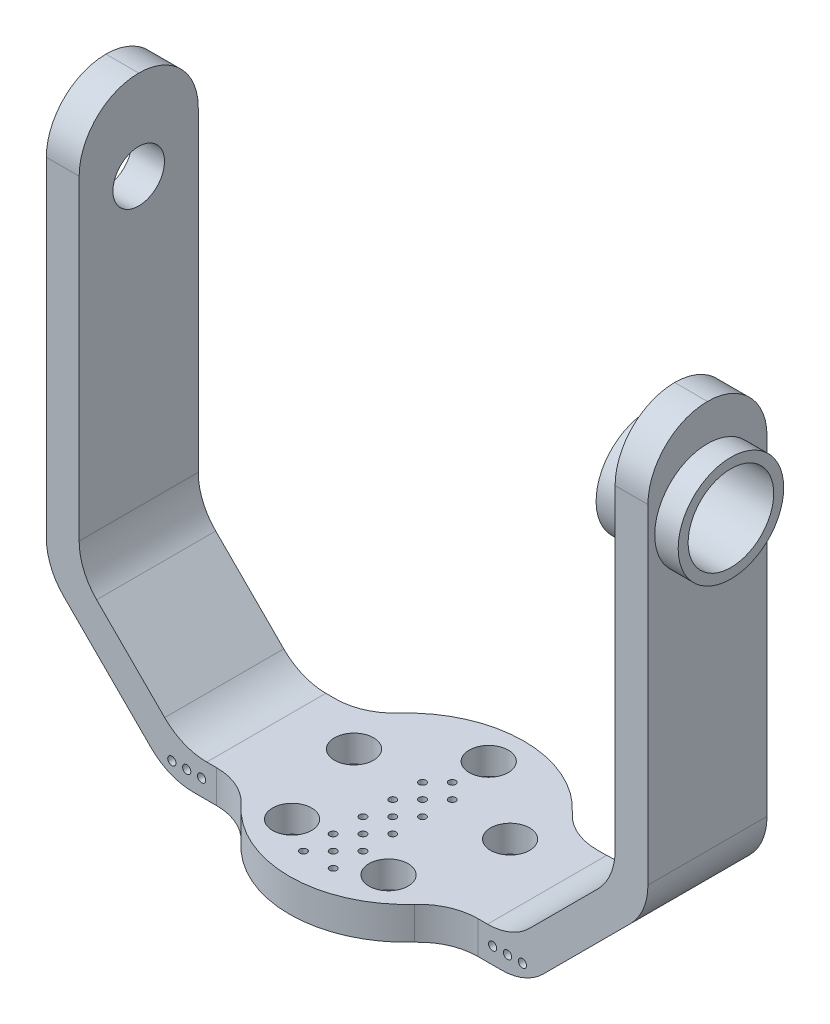
from build123d import *

# Parameters (mm, degrees)
BOSS_EXTRUDE5_DEPTH     = 50.8
SKETCH12_R              = 11
CUT_EXTRUDE2_DEPTH      = 339.34190641
SKETCH11_R              = 50
BOSS_EXTRUDE6_DEPTH     = 14
FILLET3_R               = 25.4
CUT_EXTRUDE3_DEPTH      = 262.148772557
CUT_EXTRUDE3_DEPTH_BACK = 262.148772557
SKETCH13_R              = 3.25
SKETCH14_R              = 8.33
CUT_EXTRUDE4_DEPTH      = 11.43
SKETCH15_R              = 12.5
CUT_EXTRUDE5_DEPTH      = 6.35
CUT_EXTRUDE7_DEPTH      = 262.148772557
CUT_EXTRUDE7_DEPTH_BACK = 262.148772557
SKETCH17_R              = 1.5
CUT_EXTRUDE8_DEPTH      = 262.148772557
CUT_EXTRUDE8_DEPTH_BACK = 262.148772557
SKETCH18_R              = 1.75
SKETCH20_R              = 18.25
CUT_EXTRUDE9_DEPTH      = 13.99794
SKETCH22_R              = 22.5
SKETCH22_R_2            = 18.25
BOSS_EXTRUDE8_DEPTH     = 6.00206
SKETCH23_R              = 22.5
SKETCH23_R_2            = 11.25
BOSS_EXTRUDE9_DEPTH     = 5
SKETCH24_R              = 1.75
CUT_EXTRUDE10_DEPTH     = 10
BOSS_EXTRUDE10_START    = 10
SKETCH25_R              = 22.5
SKETCH25_R_2            = 18.25
BOSS_EXTRUDE10_DEPTH    = 10


with BuildPart() as part:
    # Sketch10 → Boss-Extrude5 (new body)
    with BuildSketch(Plane.XY):
        Polygon((-114.3, 214.6), (-114.3, 43.898989873), (-70.401010127, 0), (70.401010127, 0), (114.3, 43.898989873), (114.3, 214.6), (128.29794, 214.6), (128.29794, 38.09794), (76.2, -14), (-76.2, -14), (-128.29794, 38.09794), (-128.29794, 214.6), align=None)
    extrude(amount=BOSS_EXTRUDE5_DEPTH)

    # Sketch12 → Cut-Extrude2 (cut, through all)
    with BuildSketch(Plane.ZY.offset(128.29794)):
        with Locations(Location((25.4, 176.5, 0), (0, 0, 270))):
            Circle(SKETCH12_R)
    extrude(amount=-CUT_EXTRUDE2_DEPTH, mode=Mode.SUBTRACT)

    # Sketch11 → Boss-Extrude6 (add)
    with BuildSketch(Plane(origin=(0, 0, 0), x_dir=(1, 0, 0), z_dir=(0, 1, 0))):
        with Locations((0, -25.4)):
            Circle(SKETCH11_R)
    extrude(amount=-BOSS_EXTRUDE6_DEPTH)

    # Fillet3
    fillet3_edges = [part.edges().sort_by_distance(p)[0] for p in [
        (-76.2, -14, 25.4),
        (-70.401010127, 0, 25.4),
        (-128.29794, 38.09794, 25.4),
        (-114.3, 43.898989873, 25.4),
        (121.29897, 214.6, 0),
        (121.29897, 214.6, 50.8),
        (-121.29897, 214.6, 0),
        (-121.29897, 214.6, 50.8),
        (76.2, -14, 25.4),
        (128.29794, 38.09794, 25.4),
        (114.3, 43.898989873, 25.4),
        (70.401010127, 0, 25.4),
        (-43.067853441, -7, 0),
        (43.067853441, -7, 0),
        (43.067853441, -7, 50.8),
        (-43.067853441, -7, 50.8),
    ]]
    fillet(fillet3_edges, radius=FILLET3_R - 0.0001)  # a hair under: the kernel refuses the full size

    # Sketch13 → Cut-Extrude3 (cut, two sides: drawn at the far end of the back side and taken through both)
    with BuildSketch(Plane(origin=(0, 0, 0), x_dir=(1, 0, 0), z_dir=(0, 1, 0)).offset(-CUT_EXTRUDE3_DEPTH_BACK)):
        with Locations(Location((0, 9.6, 0), (0, 0, 180))):
            Circle(SKETCH13_R)
        with Locations(Location((33.28697807, -14.584405197, 0), (0, 0, 180))):
            Circle(SKETCH13_R)
        with Locations(Location((20.57248383, -53.715594803, 0), (0, 0, 180))):
            Circle(SKETCH13_R)
        with Locations(Location((-20.57248383, -53.715594803, 0), (0, 0, 180))):
            Circle(SKETCH13_R)
        with Locations(Location((-33.28697807, -14.584405197, 0), (0, 0, 180))):
            Circle(SKETCH13_R)
    extrude(amount=CUT_EXTRUDE3_DEPTH + CUT_EXTRUDE3_DEPTH_BACK, mode=Mode.SUBTRACT)

    # Sketch14 → Cut-Extrude4 (cut)
    with BuildSketch(Plane(origin=(0, 0, 0), x_dir=(1, 0, 0), z_dir=(0, 1, 0))):
        with Locations(Location((-20.57248383, -53.715594803, 0), (0, 0, 180))):
            Circle(SKETCH14_R)
        with Locations(Location((-33.28697807, -14.584405197, 0), (0, 0, 180))):
            Circle(SKETCH14_R)
        with Locations(Location((0, 9.6, 0), (0, 0, 180))):
            Circle(SKETCH14_R)
        with Locations(Location((33.28697807, -14.584405197, 0), (0, 0, 180))):
            Circle(SKETCH14_R)
        with Locations(Location((20.57248383, -53.715594803, 0), (0, 0, 180))):
            Circle(SKETCH14_R)
    extrude(amount=-CUT_EXTRUDE4_DEPTH, mode=Mode.SUBTRACT)

    # Sketch15 → Cut-Extrude5 (cut)
    with BuildSketch(Plane(origin=(128.29794, 0, 0), x_dir=(0, 0, -1), z_dir=(1, 0, 0))):
        with Locations(Location((-25.4, 176.5, 0), (0, 0, 90))):
            Circle(SKETCH15_R)
    extrude(amount=-CUT_EXTRUDE5_DEPTH, mode=Mode.SUBTRACT)

    # Sketch17 → Cut-Extrude7 (cut, two sides: drawn at the far end of the back side and taken through both)
    with BuildSketch(Plane(origin=(0, 0, 0), x_dir=(1, 0, 0), z_dir=(0, 1, 0)).offset(-CUT_EXTRUDE7_DEPTH_BACK)):
        with Locations(Location((0, -44.05, 0), (0, 0, 180))):
            Circle(SKETCH17_R)
        with Locations(Location((0, -56.75, 0), (0, 0, 180))):
            Circle(SKETCH17_R)
        with Locations(Location((6.35, -37.7, 0), (0, 0, 180))):
            Circle(SKETCH17_R)
        with Locations(Location((6.35, -50.4, 0), (0, 0, 180))):
            Circle(SKETCH17_R)
        with Locations(Location((6.35, -63.1, 0), (0, 0, 180))):
            Circle(SKETCH17_R)
        with Locations(Location((-6.35, -37.7, 0), (0, 0, 180))):
            Circle(SKETCH17_R)
        with Locations(Location((-6.35, -50.4, 0), (0, 0, 180))):
            Circle(SKETCH17_R)
        with Locations(Location((-6.35, -63.1, 0), (0, 0, 180))):
            Circle(SKETCH17_R)
        with Locations(Location((0, -5.95, 0), (0, 0, 180))):
            Circle(SKETCH17_R)
        with Locations(Location((0, -18.65, 0), (0, 0, 180))):
            Circle(SKETCH17_R)
        with Locations(Location((0, -31.35, 0), (0, 0, 180))):
            Circle(SKETCH17_R)
        with Locations(Location((6.35, -12.3, 0), (0, 0, 180))):
            Circle(SKETCH17_R)
        with Locations(Location((6.35, -25, 0), (0, 0, 180))):
            Circle(SKETCH17_R)
        with Locations(Location((-6.35, -12.3, 0), (0, 0, 180))):
            Circle(SKETCH17_R)
        with Locations(Location((-6.35, -25, 0), (0, 0, 180))):
            Circle(SKETCH17_R)
    extrude(amount=CUT_EXTRUDE7_DEPTH + CUT_EXTRUDE7_DEPTH_BACK, mode=Mode.SUBTRACT)

    # Sketch18 → Cut-Extrude8 (cut, two sides: drawn at the far end of the back side and taken through both)
    with BuildSketch(Plane.XY.offset(50.8).offset(-CUT_EXTRUDE8_DEPTH_BACK)):
        with Locations((-74.768219641, -7)):
            Circle(SKETCH18_R)
        with Locations((62.068219641, -7)):
            Circle(SKETCH18_R)
        with Locations((68.418219641, -7)):
            Circle(SKETCH18_R)
        with Locations((74.768219641, -7)):
            Circle(SKETCH18_R)
        with Locations((-68.418219641, -7)):
            Circle(SKETCH18_R)
        with Locations((-62.068219641, -7)):
            Circle(SKETCH18_R)
    extrude(amount=CUT_EXTRUDE8_DEPTH + CUT_EXTRUDE8_DEPTH_BACK, mode=Mode.SUBTRACT)

    # Sketch20 → Cut-Extrude9 (cut)
    with BuildSketch(Plane(origin=(128.29794, 0, 0), x_dir=(0, 0, -1), z_dir=(1, 0, 0))):
        with Locations(Location((-25.4, 176.5, 0), (0, 0, 90))):
            Circle(SKETCH20_R)
    extrude(amount=-CUT_EXTRUDE9_DEPTH, mode=Mode.SUBTRACT)

    # Sketch22 → Boss-Extrude8 (add)
    with BuildSketch(Plane.ZY.offset(-114.3)):
        with Locations(Location((25.4, 176.5, 0), (0, 0, 90))):
            Circle(SKETCH22_R)
        with Locations(Location((25.4, 176.5, 0), (0, 0, 90))):
            Circle(SKETCH22_R_2, mode=Mode.SUBTRACT)
    extrude(amount=BOSS_EXTRUDE8_DEPTH)

    # Sketch23 → Boss-Extrude9 (add)
    with BuildSketch(Plane.ZY.offset(-108.29794)):
        with Locations(Location((25.4, 176.5, 0), (0, 0, 90))):
            Circle(SKETCH23_R)
        with Locations(Location((25.4, 176.5, 0), (0, 0, 270))):
            Circle(SKETCH23_R_2, mode=Mode.SUBTRACT)
    extrude(amount=BOSS_EXTRUDE9_DEPTH)

    # Sketch24 → Cut-Extrude10 (cut)
    with BuildSketch(Plane.ZY.offset(-103.29794)):
        with Locations(Location((15.500505063, 166.600505063, 0), (0, 0, 270))):
            Circle(SKETCH24_R)
        with Locations(Location((15.500505063, 186.399494937, 0), (0, 0, 270))):
            Circle(SKETCH24_R)
        with Locations(Location((35.299494937, 186.399494937, 0), (0, 0, 270))):
            Circle(SKETCH24_R)
        with Locations(Location((35.299494937, 166.600505063, 0), (0, 0, 270))):
            Circle(SKETCH24_R)
    extrude(amount=-CUT_EXTRUDE10_DEPTH, mode=Mode.SUBTRACT)

    # Sketch25 → Boss-Extrude10 (add)
    with BuildSketch(Plane(origin=(128.29794, 0, 0), x_dir=(0, 0, -1), z_dir=(1, 0, 0)).offset(BOSS_EXTRUDE10_START)):
        with Locations(Location((-25.4, 176.5, 0), (0, 0, 90))):
            Circle(SKETCH25_R)
        with Locations(Location((-25.4, 176.5, 0), (0, 0, 90))):
            Circle(SKETCH25_R_2, mode=Mode.SUBTRACT)
    extrude(amount=-BOSS_EXTRUDE10_DEPTH)


solid = part.part
